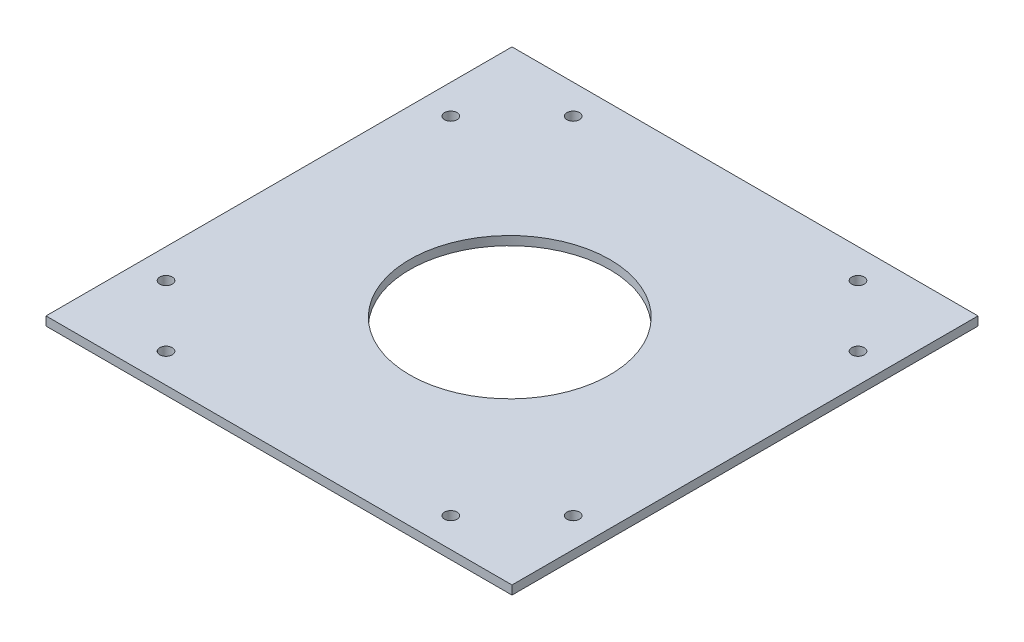
from build123d import *

# Parameters (mm, degrees)
SKETCH1_W           = 158.4
SKETCH1_H           = 158.4
BOSS_EXTRUDE1_DEPTH = 3
SKETCH2_R           = 2.125
SKETCH2_R_2         = 34
CUT_EXTRUDE3_DEPTH  = 113.045883459


with BuildPart() as part:
    # Sketch1 → Boss-Extrude1 (new body)
    with BuildSketch(Plane(origin=(0, 0, 0), x_dir=(1, 0, 0), z_dir=(0, 1, 0))):
        Rectangle(SKETCH1_W, SKETCH1_H)
    extrude(amount=BOSS_EXTRUDE1_DEPTH)

    # Sketch2 → Cut-Extrude3 (cut, through all)
    with BuildSketch(Plane(origin=(0, 3, 0), x_dir=(1, 0, 0), z_dir=(0, 1, 0))):
        with Locations((-69.2, -48.4)):
            Circle(SKETCH2_R)
        with Locations((-69.2, 48.4)):
            Circle(SKETCH2_R)
        with Locations((-48.4, 69.2)):
            Circle(SKETCH2_R)
        with Locations((48.4, 69.2)):
            Circle(SKETCH2_R)
        with Locations((69.2, 48.4)):
            Circle(SKETCH2_R)
        with Locations((69.2, -48.4)):
            Circle(SKETCH2_R)
        with Locations((48.4, -69.2)):
            Circle(SKETCH2_R)
        with Locations((-48.4, -69.2)):
            Circle(SKETCH2_R)
        with Locations((0, -0.755366495)):
            Circle(SKETCH2_R_2)
    extrude(amount=-CUT_EXTRUDE3_DEPTH, mode=Mode.SUBTRACT)


solid = part.part
